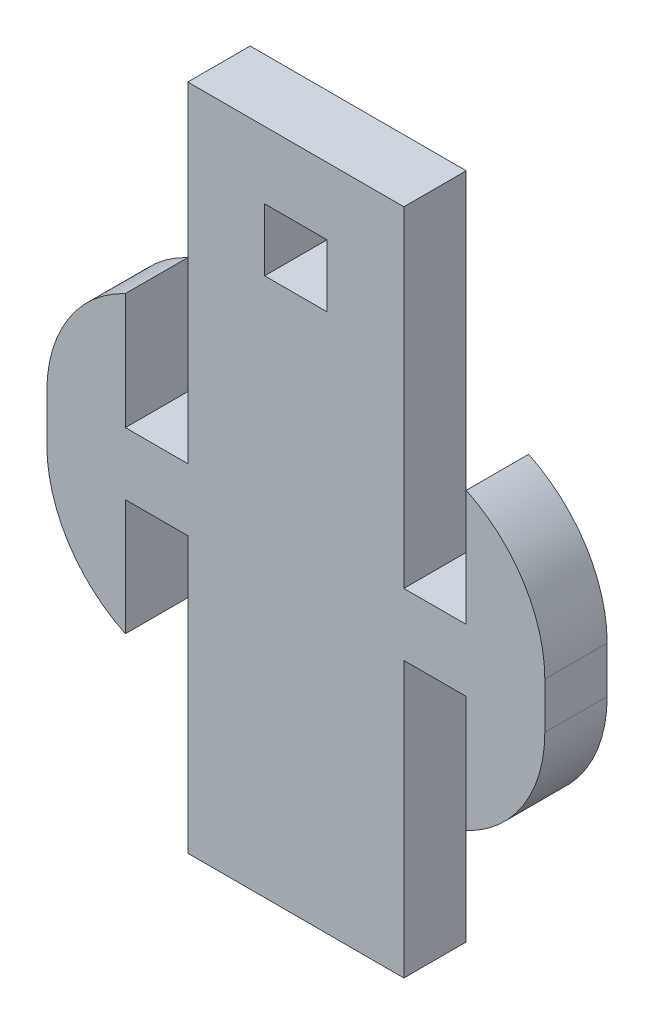
from build123d import *

# Parameters (mm, degrees)
BOSS_EXTRUDE1_DEPTH = 3.175
SKETCH2_W           = 3.175
SKETCH2_H           = 3.175
CUT_EXTRUDE1_DEPTH  = 81.096853282
SKETCH3_W           = 3.175
SKETCH3_H           = 15
BOSS_EXTRUDE2_DEPTH = 4
FILLET1_R           = 7


with BuildPart() as part:
    # Sketch1 → Boss-Extrude1 (new body)
    with BuildSketch(Plane.XY):
        Polygon((3, 45.562363311), (-3, 45.562363311), (-5.5, 45.562363311), (-5.5, 59.562363311), (-8.675, 59.562363311), (-8.675, 62.737363311), (-5.5, 62.737363311), (-5.5, 79.562363311), (5.5, 79.562363311), (5.5, 62.737363311), (8.675, 62.737363311), (8.675, 59.562363311), (5.5, 59.562363311), (5.5, 45.562363311), align=None)
    extrude(amount=BOSS_EXTRUDE1_DEPTH)

    # Sketch2 → Cut-Extrude1 (cut, through all)
    with BuildSketch(Plane(origin=(0, 0, 0), x_dir=(-1, 0, 0), z_dir=(0, 0, -1))):
        with Locations((0, 74.562363311)):
            Rectangle(SKETCH2_W, SKETCH2_H)
    extrude(amount=-CUT_EXTRUDE1_DEPTH, mode=Mode.SUBTRACT)

    # Sketch3 → Boss-Extrude2 (add)
    with BuildSketch(Plane.ZY.offset(8.675)):
        with Locations((1.5875, 61.149863311)):
            Rectangle(SKETCH3_W, SKETCH3_H)
    boss_extrude2 = extrude(amount=BOSS_EXTRUDE2_DEPTH)

    # Mirror2: Boss-Extrude2 across plane
    add(boss_extrude2.mirror(Plane(origin=(0, 0, 0), x_dir=(0, 0, 1), z_dir=(1, 0, 0))))

    # Fillet1
    # the kernel refuses this fillet: 7 mm, written as the material it takes off along each edge
    with BuildSketch(Plane(origin=(-12.675, 68.649863311, -15.811388301), x_dir=(1, 0, 0), z_dir=(0, 0, 1))) as fillet1_piece_1:
        with BuildLine():
            CenterArc((7, -6.32455532), FILLET1_R, 115.376933525, 64.623066475)
            Line((0, -6.32455532), (-0.14, -6.32455532))
            Line((-0.14, -6.32455532), (-0.14, 0))
            Line((-0.14, 0), (0, 0.14))
            ThreePointArc((0, 0.14), (2, 0.14), (3.94, 0.126491106))
            Line((3.94, 0.126491106), (4, 0))
        make_face()
    extrude(amount=34.797776602, mode=Mode.SUBTRACT)
    with BuildSketch(Plane(origin=(-12.675, 53.649863311, 18.986388301), x_dir=(0, 1, 0), z_dir=(0, 0, -1))) as fillet1_piece_2:
        with BuildLine():
            CenterArc((6.32455532, 7), FILLET1_R, 205.376933525, 64.623066475)
            Line((0, 4), (-0.126491106, 3.94))
            ThreePointArc((-0.126491106, 3.94), (-0.14, 2), (-0.14, 0))
            Line((-0.14, 0), (0, -0.14))
            Line((0, -0.14), (6.32455532, -0.14))
            Line((6.32455532, -0.14), (6.32455532, 0))
        make_face()
    extrude(amount=34.797776602, mode=Mode.SUBTRACT)
    with BuildSketch(Plane(origin=(12.675, 68.649863311, -15.811388301), x_dir=(0, -1, 0), z_dir=(0, 0, 1))) as fillet1_piece_3:
        with BuildLine():
            CenterArc((6.32455532, -7), FILLET1_R, 90, 64.623066475)
            Line((0, -4), (-0.126491106, -3.94))
            ThreePointArc((-0.126491106, -3.94), (-0.14, -2), (-0.14, 0))
            Line((-0.14, 0), (0, 0.14))
            Line((0, 0.14), (6.32455532, 0.14))
            Line((6.32455532, 0.14), (6.32455532, 0))
        make_face()
    extrude(amount=34.797776602, mode=Mode.SUBTRACT)
    with BuildSketch(Plane(origin=(12.675, 53.649863311, 18.986388301), x_dir=(-1, 0, 0), z_dir=(0, 0, -1))) as fillet1_piece_4:
        with BuildLine():
            CenterArc((7, 6.32455532), FILLET1_R, 180, 64.623066475)
            Line((0, 6.32455532), (-0.14, 6.32455532))
            Line((-0.14, 6.32455532), (-0.14, 0))
            Line((-0.14, 0), (0, -0.14))
            ThreePointArc((0, -0.14), (2, -0.14), (3.94, -0.126491106))
            Line((3.94, -0.126491106), (4, 0))
        make_face()
    extrude(amount=34.797776602, mode=Mode.SUBTRACT)


solid = part.part
